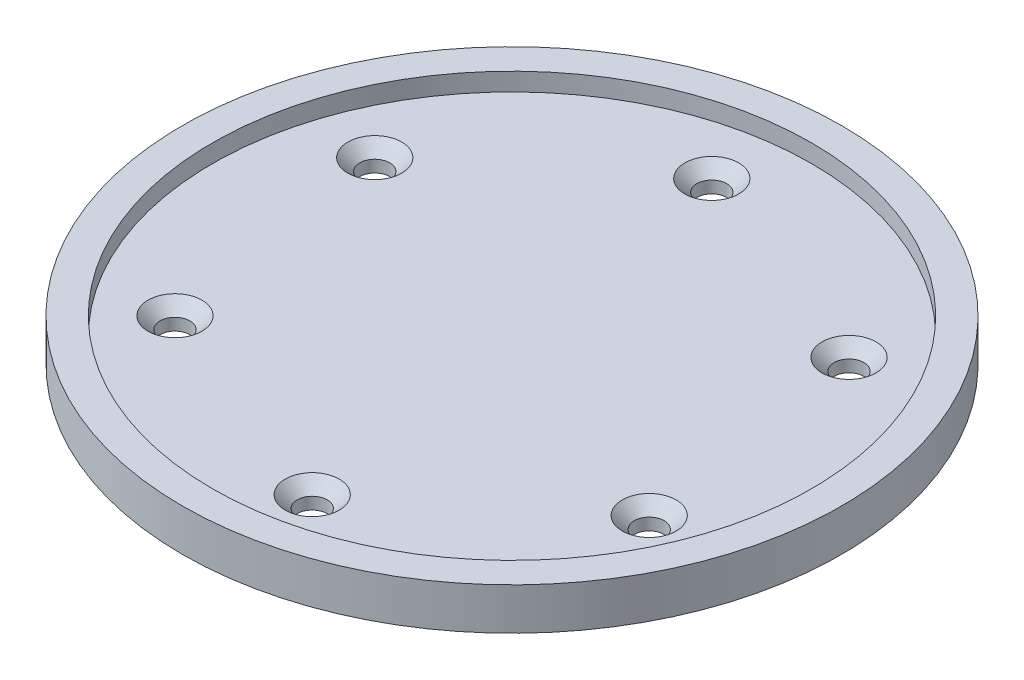
from build123d import *

# Parameters (mm, degrees)
SKETCH2_R          = 2.5
CUT_EXTRUDE1_DEPTH = 78.884529914
CHAMFER1_SIZE      = 2


with BuildPart() as part:
    # Sketch1 → Revolve1 (revolve)
    with BuildSketch(Plane.XY):
        Polygon((50, 3.478641915), (50, 6.478641915), (55, 6.478641915), (55, -0.521358085), (0, -0.521358085), (0, 3.478641915), align=None)
    revolve(axis=Axis((0, 0, 0), (0, 1, 0)))

    # Sketch2 → Cut-Extrude1 (cut, through all)
    with BuildSketch(Plane(origin=(0, 3.478641915, 0), x_dir=(1, 0, 0), z_dir=(0, 1, 0))):
        with Locations((-6.177388612, 39.520119812)):
            Circle(SKETCH2_R)
        with Locations((-37.314122023, 14.410284439)):
            Circle(SKETCH2_R)
        with Locations((-31.136733412, -25.109835373)):
            Circle(SKETCH2_R)
        with Locations((6.177388612, -39.520119812)):
            Circle(SKETCH2_R)
        with Locations((37.314122023, -14.410284439)):
            Circle(SKETCH2_R)
        with Locations((31.136733412, 25.109835373)):
            Circle(SKETCH2_R)
    extrude(amount=-CUT_EXTRUDE1_DEPTH, mode=Mode.SUBTRACT)

    # Chamfer1
    chamfer1_edges = [part.edges().sort_by_distance(p)[0] for p in [
        (28.636733412, 3.478641915, -25.109835373),
        (34.814122023, 3.478641915, 14.410284439),
        (-33.636733412, 3.478641915, 25.109835373),
        (-39.814122023, 3.478641915, -14.410284439),
        (-8.677388612, 3.478641915, -39.520119812),
        (3.677388612, 3.478641915, 39.520119812),
    ]]
    chamfer(chamfer1_edges, length=CHAMFER1_SIZE)


solid = part.part
